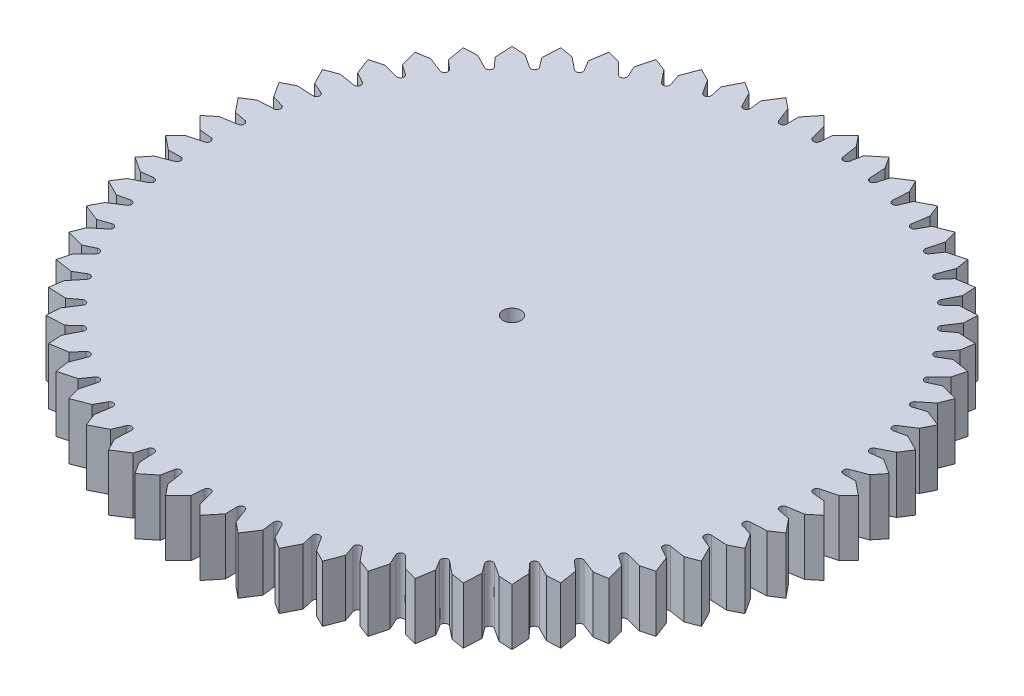
from build123d import *

# Parameters (mm, degrees)
BOSS_EXTRUDE1_DEPTH = 6
CIRPATTERN1_COUNT   = 60
CUT_EXTRUDE1_DEPTH  = 50.7924625
CIRPATTERN2_COUNT   = 60
SKETCH3_R           = 0.95
CUT_EXTRUDE2_DEPTH  = 50.7924625


with BuildPart() as part:
    # Sketch1 → Boss-Extrude1 (new body)
    with BuildSketch(Plane(origin=(0, 0, 0), x_dir=(1, 0, 0), z_dir=(0, 1, 0))):
        Polygon((0, 0), (33.120275248, 0), (34.952033716, 1.831758469), (32.938838915, 3.462011475), align=None)
    boss_extrude1 = extrude(amount=BOSS_EXTRUDE1_DEPTH)

    # CirPattern1: Boss-Extrude1 ×60 about axis
    cirpattern1_axis = Axis((0, 6, 0), (0, -1, 0))
    for i in range(1, CIRPATTERN1_COUNT):
        add(boss_extrude1.rotate(cirpattern1_axis, i * 360 / CIRPATTERN1_COUNT))

    # Sketch2 → Cut-Extrude1 (cut, through all)
    with BuildSketch(Plane(origin=(0, 6, 0), x_dir=(1, 0, 0), z_dir=(0, 1, 0))):
        with BuildLine():
            Line((33.60470642, -0.484431173), (32.337591844, -0.373573012))
            ThreePointArc((32.337591844, -0.373573012), (31.996702236, -0.032683404), (32.273218106, 0.362222185))
            Line((32.273218106, 0.362222185), (33.925124387, 0.804849139))
            Line((33.925124387, 0.804849139), (33.120275248, 0))
            Line((33.120275248, 0), (33.60470642, -0.484431173))
        make_face()
    cut_extrude1 = extrude(amount=-CUT_EXTRUDE1_DEPTH, mode=Mode.SUBTRACT)

    # CirPattern2: Cut-Extrude1 ×60 about axis
    cirpattern2_axis = Axis((0, 6, 0), (0, -1, 0))
    for i in range(1, CIRPATTERN2_COUNT):
        add(cut_extrude1.rotate(cirpattern2_axis, i * 360 / CIRPATTERN2_COUNT), mode=Mode.SUBTRACT)

    # Sketch3 → Cut-Extrude2 (cut, through all)
    with BuildSketch(Plane(origin=(0, 6, 0), x_dir=(1, 0, 0), z_dir=(0, 1, 0))):
        Circle(SKETCH3_R)
    extrude(amount=-CUT_EXTRUDE2_DEPTH, mode=Mode.SUBTRACT)


solid = part.part
